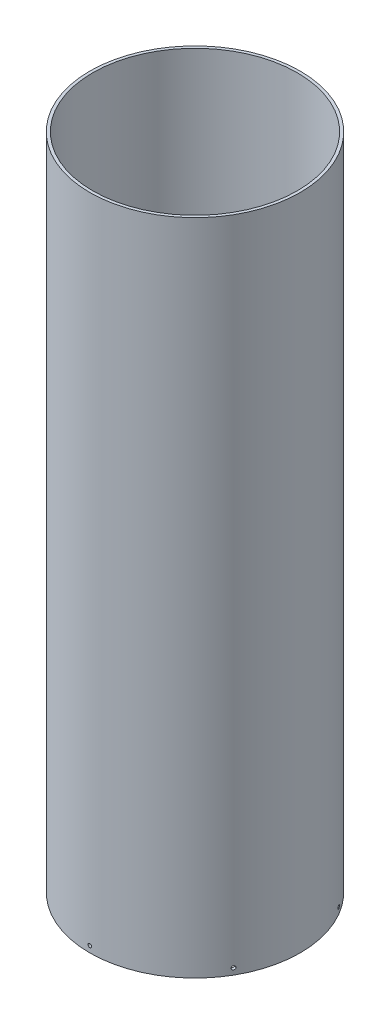
from build123d import *

# Parameters (mm, degrees)
SKETCH1_R           = 78.359
SKETCH1_R_2         = 76.2
BOSS_EXTRUDE1_DEPTH = 490.5375
SKETCH2_R           = 1.35255
CUT_EXTRUDE1_DEPTH  = 503.898901041
CIRPATTERN1_COUNT   = 6


with BuildPart() as part:
    # Sketch1 → Boss-Extrude1 (new body)
    with BuildSketch(Plane(origin=(0, 0, 0), x_dir=(1, 0, 0), z_dir=(0, 1, 0))):
        Circle(SKETCH1_R)
        Circle(SKETCH1_R_2, mode=Mode.SUBTRACT)
    extrude(amount=BOSS_EXTRUDE1_DEPTH)

    # Sketch2 → Cut-Extrude1 (cut, through all)
    with BuildSketch(Plane.XY):
        with Locations((0, 4.7625)):
            Circle(SKETCH2_R)
    cut_extrude1 = extrude(amount=-CUT_EXTRUDE1_DEPTH, mode=Mode.SUBTRACT)

    # CirPattern1: Cut-Extrude1 ×6 about axis
    cirpattern1_axis = Axis((0, 490.5375, 0), (0, -1, 0))
    for i in range(1, CIRPATTERN1_COUNT):
        add(cut_extrude1.rotate(cirpattern1_axis, i * 360 / CIRPATTERN1_COUNT), mode=Mode.SUBTRACT)


solid = part.part
